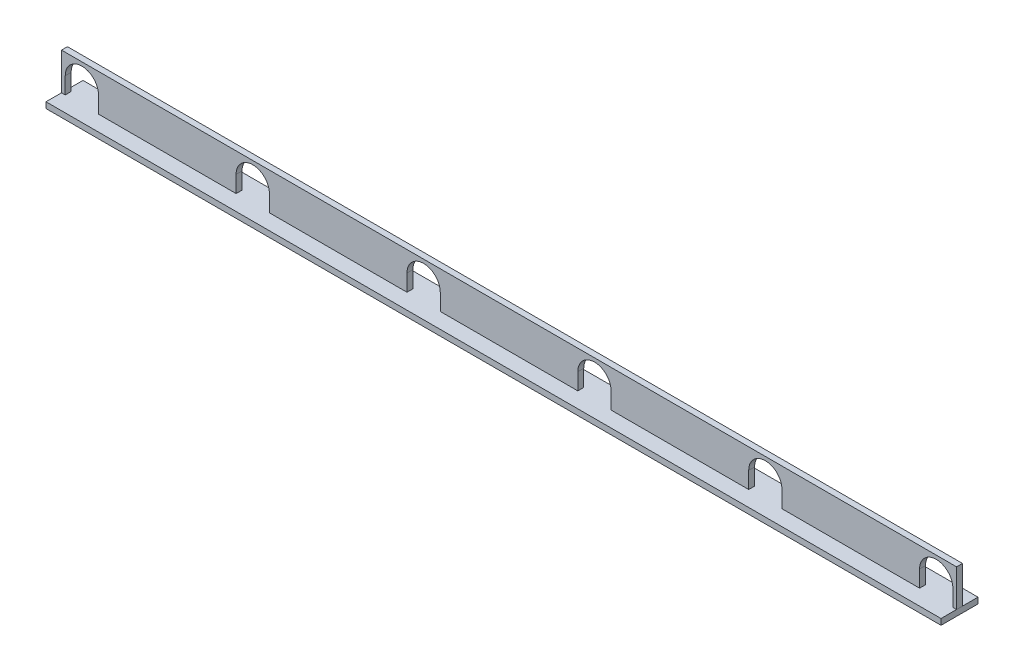
from build123d import *

# Parameters (mm, degrees)
EXTRUDE_1_DEPTH = 4
SKETCH_2_W      = 1210
SKETCH_2_H      = 50
EXTRUDE_2_DEPTH = 8


with BuildPart() as part:
    # Эскиз1 → Бобышка-Вытянуть1 (new, symmetric)
    with BuildSketch(Plane.XY):
        with BuildLine():
            Line((-600, -2.5), (-600, -25))
            Line((-600, -25), (-605, -25))
            Line((-605, -25), (-605, 25))
            Line((-605, 25), (605, 25))
            Line((605, 25), (605, -25))
            Line((605, -25), (600, -25))
            Line((600, -25), (600, -2.5))
            ThreePointArc((600, -2.5), (577.5, 20), (555, -2.5))
            Line((555, -2.5), (555, -25))
            Line((555, -25), (369, -25))
            Line((369, -25), (369, -2.5))
            ThreePointArc((369, -2.5), (346.5, 20), (324, -2.5))
            Line((324, -2.5), (324, -25))
            Line((324, -25), (138, -25))
            Line((138, -25), (138, -2.5))
            ThreePointArc((138, -2.5), (115.5, 20), (93, -2.5))
            Line((93, -2.5), (93, -25))
            Line((93, -25), (-93, -25))
            Line((-93, -25), (-93, -2.5))
            ThreePointArc((-93, -2.5), (-115.5, 20), (-138, -2.5))
            Line((-138, -2.5), (-138, -25))
            Line((-138, -25), (-324, -25))
            Line((-324, -25), (-324, -2.5))
            ThreePointArc((-324, -2.5), (-346.5, 20), (-369, -2.5))
            Line((-369, -2.5), (-369, -25))
            Line((-369, -25), (-555, -25))
            Line((-555, -25), (-555, -2.5))
            ThreePointArc((-555, -2.5), (-577.5, 20), (-600, -2.5))
        make_face()
    extrude(amount=EXTRUDE_1_DEPTH, both=True)


with BuildPart() as body_2:
    # Эскиз2 → Бобышка-Вытянуть2 (new body)
    with BuildSketch(Plane.XZ.offset(25)):
        Rectangle(SKETCH_2_W, SKETCH_2_H)
    extrude(amount=EXTRUDE_2_DEPTH)


solid = Compound([part.part, body_2.part])
